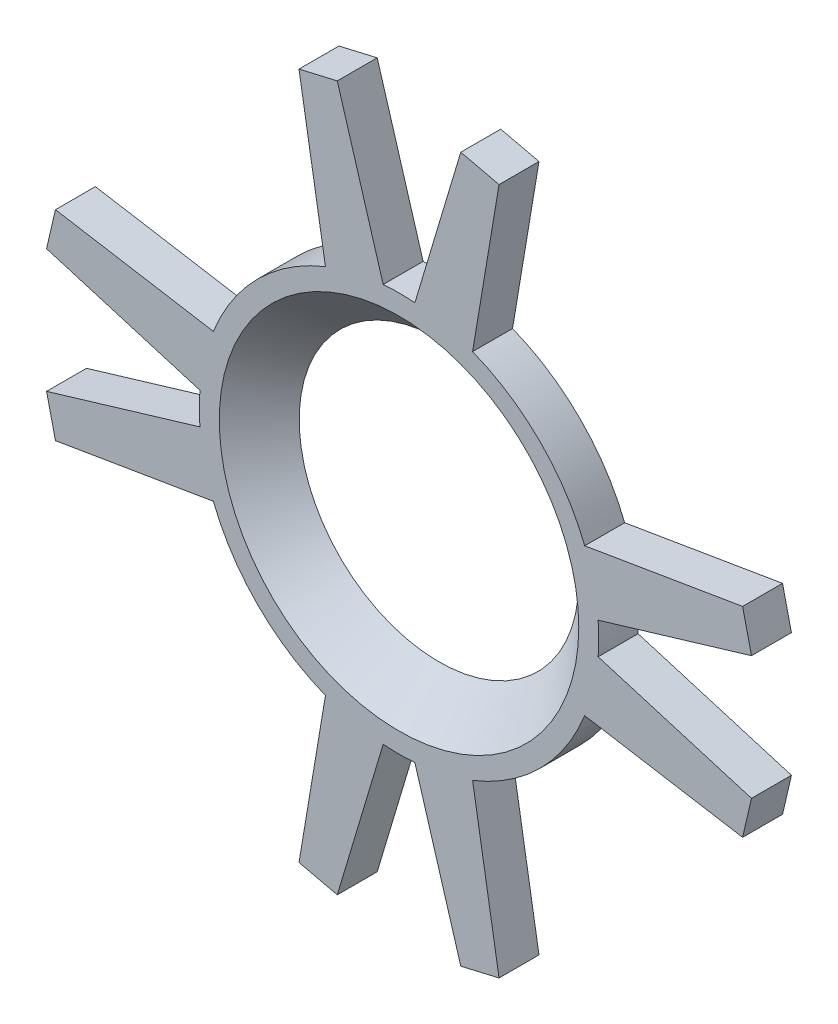
from build123d import *

# Parameters (mm, degrees)
SKETCH_1_R              = 20
EXTRUDE_1_DEPTH         = 2
SKETCH_2_R              = 7
CUT_EXTRUDE_1_DEPTH     = 2
CUT_EXTRUDE_START       = -2
CUT_EXTRUDE_2_OUTLINE_R = 20
CUT_EXTRUDE_2_DEPTH     = 2
CHAMFER_4_SIZE          = 2


# Read off the part's stored shape, not the designer's step: 切除-拉伸2
with BuildPart() as part:
    # 草图1 → 凸台-拉伸1 (new body)
    with BuildSketch(Plane.XY):
        Circle(SKETCH_1_R)
    extrude(amount=EXTRUDE_1_DEPTH)

    # 草图2 → 切除-拉伸1 (cut)
    with BuildSketch(Plane.XY.offset(2)):
        Circle(SKETCH_2_R)
    extrude(amount=-CUT_EXTRUDE_1_DEPTH, mode=Mode.SUBTRACT)

    # 切除-拉伸2 outline → 切除-拉伸2 (cut)
    with BuildSketch(Plane.XY.offset(2).offset(CUT_EXTRUDE_START)):
        Circle(CUT_EXTRUDE_2_OUTLINE_R)
        with BuildLine():
            Line((-3.683674436, 9.296802819), (-5.007717322, 17.202301566))
            Line((-5.007717322, 17.202301566), (-3.091969732, 17.647553233))
            Line((-3.091969732, 17.647553233), (-0.793888425, 9.968437248))
            ThreePointArc((-0.793888425, 9.968437248), (0, 10), (0.793888425, 9.968437248))
            Line((0.793888425, 9.968437248), (3.091969732, 17.647553233))
            Line((3.091969732, 17.647553233), (5.007717322, 17.202301566))
            Line((5.007717322, 17.202301566), (3.683674436, 9.296802819))
            ThreePointArc((3.683674436, 9.296802819), (7.071067812, 7.071067812), (9.296802819, 3.683674436))
            Line((9.296802819, 3.683674436), (17.202301566, 5.007717322))
            Line((17.202301566, 5.007717322), (17.647553233, 3.091969732))
            Line((17.647553233, 3.091969732), (9.968437248, 0.793888425))
            ThreePointArc((9.968437248, 0.793888425), (10, 0), (9.968437248, -0.793888425))
            Line((9.968437248, -0.793888425), (17.647553233, -3.091969732))
            Line((17.647553233, -3.091969732), (17.202301566, -5.007717322))
            Line((17.202301566, -5.007717322), (9.296802819, -3.683674436))
            ThreePointArc((9.296802819, -3.683674436), (7.071067812, -7.071067812), (3.683674436, -9.296802819))
            Line((3.683674436, -9.296802819), (5.007717322, -17.202301566))
            Line((5.007717322, -17.202301566), (3.091969732, -17.647553233))
            Line((3.091969732, -17.647553233), (0.793888425, -9.968437248))
            ThreePointArc((0.793888425, -9.968437248), (0, -10), (-0.793888425, -9.968437248))
            Line((-0.793888425, -9.968437248), (-3.091969732, -17.647553233))
            Line((-3.091969732, -17.647553233), (-5.007717322, -17.202301566))
            Line((-5.007717322, -17.202301566), (-3.683674436, -9.296802819))
            ThreePointArc((-3.683674436, -9.296802819), (-7.071067812, -7.071067812), (-9.296802819, -3.683674436))
            Line((-9.296802819, -3.683674436), (-17.202301566, -5.007717322))
            Line((-17.202301566, -5.007717322), (-17.647553233, -3.091969732))
            Line((-17.647553233, -3.091969732), (-9.968437248, -0.793888425))
            ThreePointArc((-9.968437248, -0.793888425), (-10, 0), (-9.968437248, 0.793888425))
            Line((-9.968437248, 0.793888425), (-17.647553233, 3.091969732))
            Line((-17.647553233, 3.091969732), (-17.202301566, 5.007717322))
            Line((-17.202301566, 5.007717322), (-9.296802819, 3.683674436))
            ThreePointArc((-9.296802819, 3.683674436), (-7.071067812, 7.071067812), (-3.683674436, 9.296802819))
        make_face(mode=Mode.SUBTRACT)
    extrude(amount=CUT_EXTRUDE_2_DEPTH, mode=Mode.SUBTRACT)

    # 倒角4
    chamfer_4_edges = [part.edges().sort_by_distance(p)[0] for p in [
        (-7, 0, 2),
    ]]
    chamfer(chamfer_4_edges, length=CHAMFER_4_SIZE - 0.0001)  # a hair under: the kernel refuses the full size


solid = part.part
